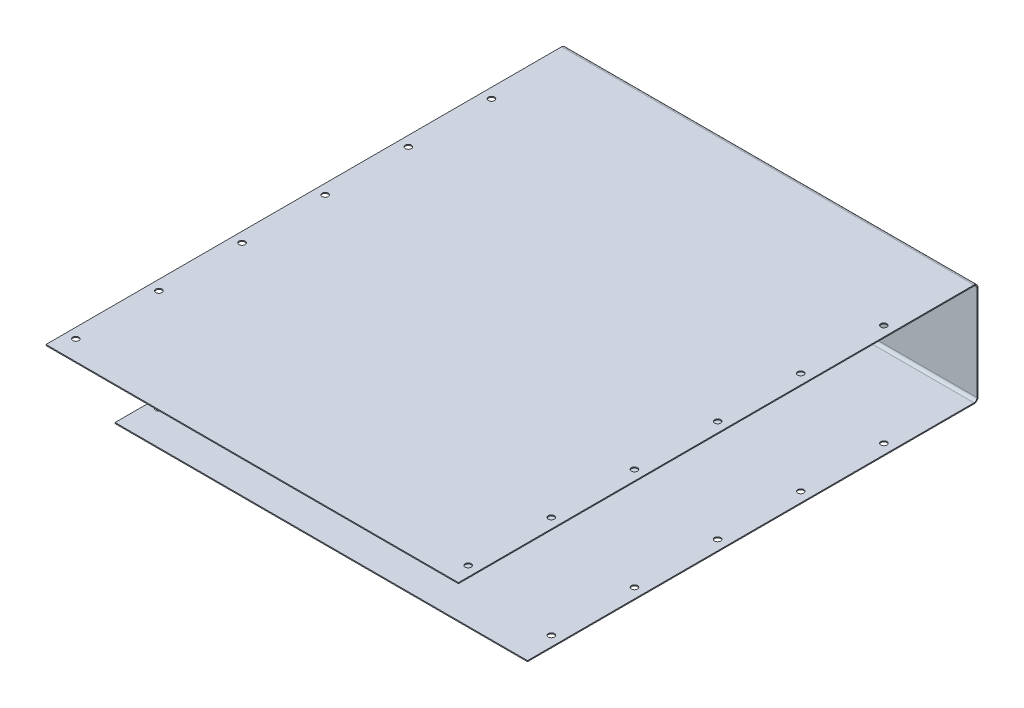
from build123d import *

# Parameters (mm, degrees)
SKETCH1_W               = 412
SKETCH1_H               = 515
BASE_FLANGE1_DEPTH      = 1
EDGE_FLANGE1_DEPTH      = 412
EDGE_FLANGE2_DEPTH      = 412
CUT_EXTRUDE1_DEPTH      = 349.464130148
CUT_EXTRUDE1_DEPTH_BACK = 349.464130148
SKETCH12_R              = 3.05


# Sheet-metal steps are written as plain solids
with BuildPart() as part:
    # Sketch1 → Base-Flange1 (new body)
    with BuildSketch(Plane(origin=(0, 0, 0), x_dir=(1, 0, 0), z_dir=(0, 1, 0))):
        Rectangle(SKETCH1_W, SKETCH1_H)
    extrude(amount=-BASE_FLANGE1_DEPTH)

    # Edge-Flange1 section (across the edge) → Edge-Flange1 (add)
    with BuildSketch(Plane(origin=(-206, -1, -260.5), x_dir=(0, 0, 1), z_dir=(1, 0, 0))):
        with BuildLine():
            Line((-1, 3), (-1, 98))
            Line((-1, 98), (0, 98))
            Line((0, 98), (0, 3))
            ThreePointArc((0, 3), (0.878679656, 0.878679656), (3, 0))
            Line((3, 0), (3, -1))
            ThreePointArc((3, -1), (0.171572875, 0.171572875), (-1, 3))
        make_face()
    extrude(amount=EDGE_FLANGE1_DEPTH)

    # Edge-Flange2 section (across the edge) → Edge-Flange2 (add)
    with BuildSketch(Plane(origin=(-206, -102, -260.5), x_dir=(0, 1, 0), z_dir=(1, 0, 0))):
        with BuildLine():
            Line((-1, 3), (-1, 449))
            Line((-1, 449), (0, 449))
            Line((0, 449), (0, 3))
            ThreePointArc((0, 3), (0.878679656, 0.878679656), (3, 0))
            Line((3, 0), (3, -1))
            ThreePointArc((3, -1), (0.171572875, 0.171572875), (-1, 3))
        make_face()
    extrude(amount=EDGE_FLANGE2_DEPTH)

    # Sketch12 → Cut-Extrude1 (cut, two sides: drawn at the far end of the back side and taken through both)
    with BuildSketch(Plane(origin=(0, 0, 0), x_dir=(1, 0, 0), z_dir=(0, 1, 0)).offset(-CUT_EXTRUDE1_DEPTH_BACK)):
        with Locations(Location((196, 177.5, 0), (0, 0, 270))):
            Circle(SKETCH12_R)
        with Locations(Location((196, 94.45, 0), (0, 0, 270))):
            Circle(SKETCH12_R)
        with Locations(Location((196, 11.4, 0), (0, 0, 270))):
            Circle(SKETCH12_R)
        with Locations(Location((196, -71.65, 0), (0, 0, 270))):
            Circle(SKETCH12_R)
        with Locations(Location((196, -154.7, 0), (0, 0, 270))):
            Circle(SKETCH12_R)
        with Locations(Location((196, -237.75, 0), (0, 0, 90))):
            Circle(SKETCH12_R)
        with Locations(Location((-196, -237.75, 0), (0, 0, 90))):
            Circle(SKETCH12_R)
        with Locations(Location((-196, -154.7, 0), (0, 0, 270))):
            Circle(SKETCH12_R)
        with Locations(Location((-196, -71.65, 0), (0, 0, 270))):
            Circle(SKETCH12_R)
        with Locations(Location((-196, 11.4, 0), (0, 0, 270))):
            Circle(SKETCH12_R)
        with Locations(Location((-196, 94.45, 0), (0, 0, 270))):
            Circle(SKETCH12_R)
        with Locations(Location((-196, 177.5, 0), (0, 0, 270))):
            Circle(SKETCH12_R)
    extrude(amount=CUT_EXTRUDE1_DEPTH + CUT_EXTRUDE1_DEPTH_BACK, mode=Mode.SUBTRACT)


solid = part.part
